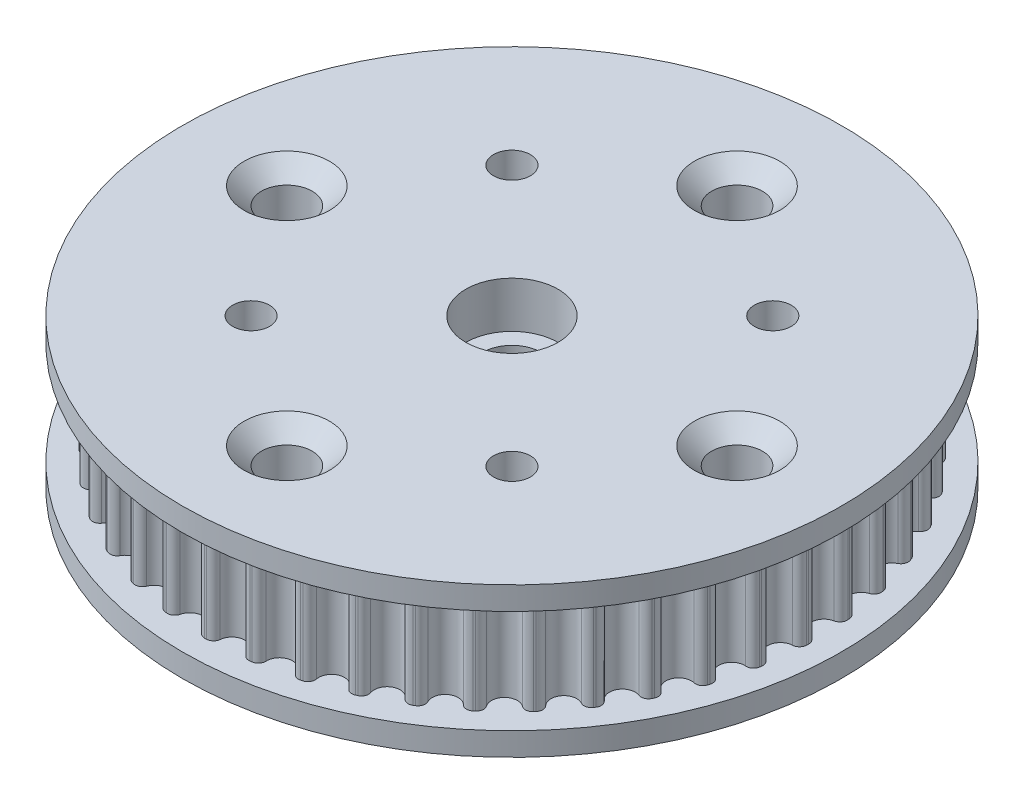
from build123d import *
from build123d.topology import SkipClean

# Parameters (mm, degrees)
BOSS_EXTRUDE1_DEPTH     = 3.556
CIRPATTERN1_COUNT       = 45
SKETCH2_W               = 20.692208267
SKETCH2_H               = 1.5875
CUT_EXTRUDE1_DEPTH      = 34.249871163
CUT_EXTRUDE1_DEPTH_BACK = 34.249871163
SKETCH3_R               = 1.74625
SKETCH3_R_2             = 2
SKETCH3_R_3             = 1.27
CIRPATTERN2_COUNT       = 4
SKETCH8_R               = 3.175
CUT_EXTRUDE6_DEPTH      = 3.175


with BuildPart() as part:
    # Sketch1 → Boss-Extrude1 (new, symmetric)
    with BuildSketch(Plane(origin=(0, 0, 0), x_dir=(1, 0, 0), z_dir=(0, 1, 0))):
        with BuildLine():
            ThreePointArc((0, 19.884811005), (0.578412474, 20.098394706), (0.879208145, 20.636633455))
            ThreePointArc((0.879208145, 20.636633455), (1.061044452, 20.949637237), (1.406466311, 21.057894109))
            ThreePointArc((1.406466311, 21.057894109), (1.472197202, 21.053400846), (1.537913746, 21.048702409))
            ThreePointArc((1.537913746, 21.048702409), (1.864907538, 20.893425655), (2.00141252, 20.558161281))
            ThreePointArc((2.00141252, 20.558161281), (2.224372512, 19.983297968), (2.76743081, 19.691293391))
            ThreePointArc((2.76743081, 19.691293391), (-1.387094297, -19.836372605), (0, 19.884811005))
        make_face()
    boss_extrude1 = extrude(amount=BOSS_EXTRUDE1_DEPTH, both=True)

    # CirPattern1: Boss-Extrude1 ×45 about axis
    cirpattern1_axis = Axis((0, 3.3, 0), (0, -1, 0))
    for i in range(1, CIRPATTERN1_COUNT):
        add(boss_extrude1.rotate(cirpattern1_axis, i * 360 / CIRPATTERN1_COUNT))

    # Sketch2 → Revolve3 (revolve)
    with BuildSketch(Plane(origin=(0, 0, 0), x_dir=(0, 0, -1), z_dir=(1, 0, 0))):
        with Locations((12.346104134, 4.34975)):
            Rectangle(SKETCH2_W, SKETCH2_H)
    revolve3 = revolve(axis=Axis((0, 3.3, 0), (0, -1, 0)))

    # Mirror1: Revolve3 across plane
    add(revolve3.mirror(Plane.ZX))

    # Sketch3 → Cut-Extrude1 (cut, two sides: drawn at the far end of the back side and taken through both)
    with SkipClean():  # the faces are left unmerged after this step: merging them gives an invalid solid
        with BuildSketch(Plane(origin=(0, 3.556, 0), x_dir=(1, 0, 0), z_dir=(0, 1, 0)).offset(-CUT_EXTRUDE1_DEPTH_BACK)):
            with Locations((-15.5, 0)):
                Circle(SKETCH3_R)
            Circle(SKETCH3_R_2)
            with Locations((0, 15.5)):
                Circle(SKETCH3_R)
            with Locations((15.5, 0)):
                Circle(SKETCH3_R)
            with Locations((0, -15.5)):
                Circle(SKETCH3_R)
            with Locations((-8.980256121, 8.980256121)):
                Circle(SKETCH3_R_3)
            with Locations((8.980256121, 8.980256121)):
                Circle(SKETCH3_R_3)
            with Locations((8.980256121, -8.980256121)):
                Circle(SKETCH3_R_3)
            with Locations((-8.980256121, -8.980256121)):
                Circle(SKETCH3_R_3)
        extrude(amount=CUT_EXTRUDE1_DEPTH + CUT_EXTRUDE1_DEPTH_BACK, mode=Mode.SUBTRACT)

    # Sketch6 → Cut-Revolve2 (revolve, cut)
    with SkipClean():  # the faces are left unmerged after this step: merging them gives an invalid solid
        with BuildSketch(Plane.XY):
            Polygon((-12.5625, 5.1435), (-15.5, 2.206), (-15.5, 5.1435), align=None)
        cut_revolve2 = revolve(axis=Axis((-15.5, -5.1435, 0), (0, 1, 0)), mode=Mode.SUBTRACT)

    # CirPattern2: Cut-Revolve2 ×4 about axis
    with SkipClean():  # the faces are left unmerged after this step: merging them gives an invalid solid
        cirpattern2_axis = Axis((0, 3.3, 0), (0, -1, 0))
        for i in range(1, CIRPATTERN2_COUNT):
            add(cut_revolve2.rotate(cirpattern2_axis, i * 360 / CIRPATTERN2_COUNT), mode=Mode.SUBTRACT)

    # Sketch8 → Cut-Extrude6 (cut)
    with SkipClean():  # the faces are left unmerged after this step: merging them gives an invalid solid
        with BuildSketch(Plane(origin=(0, 5.1435, 0), x_dir=(1, 0, 0), z_dir=(0, 1, 0))):
            Circle(SKETCH8_R)
        extrude(amount=-CUT_EXTRUDE6_DEPTH, mode=Mode.SUBTRACT)


solid = part.part
